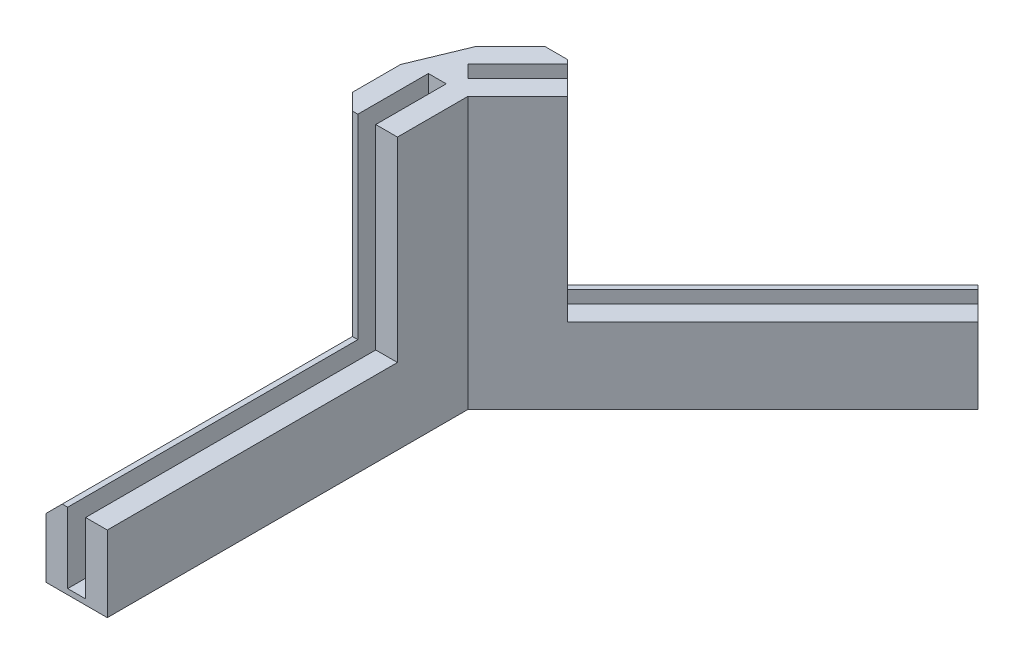
from build123d import *

# Parameters (mm, degrees)
BOSS_EXTRUDE1_DEPTH = 50
SKETCH3_W           = 3.3
SKETCH3_H           = 1
BOSS_EXTRUDE2_DEPTH = 13
BOSS_EXTRUDE3_DEPTH = 53.5
CHAMFER1_START      = -14
CHAMFER1_OUTLINE_W  = 52
CHAMFER1_OUTLINE_H  = 13
CHAMFER1_DEPTH      = 3.182909169
CHAMFER2_SIZE       = 3


with BuildPart() as part:
    # Sketch2 → Boss-Extrude1 (new body)
    with BuildSketch(Plane(origin=(0, 0, 0), x_dir=(1, 0, 0), z_dir=(0, 1, 0))):
        Polygon((-1.7, -2), (-1.7, -15), (-5.7, -15), (-5.7, -2), (-9, -2), (-9, -15), (-13, -15), (-13, 2.680601608), align=None)
    extrude(amount=BOSS_EXTRUDE1_DEPTH)

    # Sketch3 → Boss-Extrude2 (add)
    with BuildSketch(Plane.XY.offset(2)):
        with Locations((-7.35, 0.5)):
            Rectangle(SKETCH3_W, SKETCH3_H)
    extrude(amount=BOSS_EXTRUDE2_DEPTH)

    # Sketch5 → Boss-Extrude3 (add)
    with BuildSketch(Plane.XY.offset(15)):
        Polygon((-13, 0), (-1.7, 0), (-1.7, 14), (-5.7, 14), (-5.7, 1), (-9, 1), (-9, 14), (-13, 14), align=None)
    extrude(amount=BOSS_EXTRUDE3_DEPTH)

    # Mirror1: part across plane


with BuildPart() as part_1:
    add(part.part)
    add(part.part.mirror(Plane(origin=(-0.956063716, 0, 2.308147732), x_dir=(0.9238798691632129, 0, 0.38268261961443256), z_dir=(0.3826826196144326, 0, -0.9238798691632131))))

    # Chamfer1: read off the stored shape, not the designer's step
    # Chamfer1 outline → Chamfer1 (cut)
    with BuildSketch(Plane(origin=(0, 0, 0), x_dir=(0, 1, 0), z_dir=(0.9238798691632129, 0, 0.38268261961443295)).offset(CHAMFER1_START)):
        with Locations((25, 2.5)):
            Rectangle(CHAMFER1_OUTLINE_W, CHAMFER1_OUTLINE_H)
    extrude(amount=CHAMFER1_DEPTH, mode=Mode.SUBTRACT)

    # Chamfer2
    chamfer2_edges = [part_1.edges().sort_by_distance(p)[0] for p in [
        (-13, 32, 15),
        (-13, 14, 41.75),
        (-0.497948704, 32, -15.182696898),
        (18.417124413, 14, -34.097836574),
    ]]
    chamfer(chamfer2_edges, length=CHAMFER2_SIZE)


solid = part_1.part
